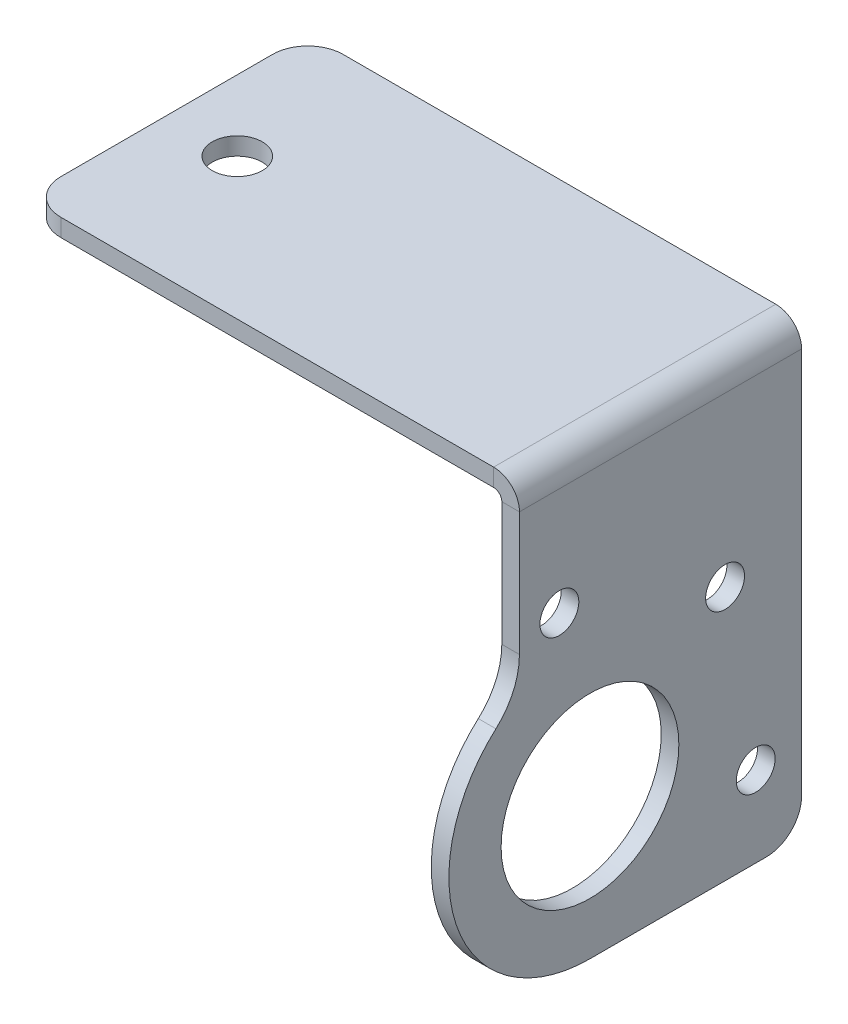
from build123d import *

# Parameters (mm, degrees)
SKETCH1_R                    = 2.25
SKETCH1_R_2                  = 8
SKETCH1_R_3                  = 1.75
BASE_FLANGE1_DEPTH           = 1.5875
SKETCHED_START               = 38.1
SKETCHED_BEND1_OUTLINE_W     = 1.5875
SKETCHED_BEND1_OUTLINE_H     = 25.4
SKETCHED_BEND1_DEPTH         = 38.1
SKETCHED_START_2             = 36.5125
SKETCHED_BEND1_2_OUTLINE_R   = 1.75
SKETCHED_BEND1_2_OUTLINE_R_2 = 8
SKETCHED_BEND1_2_DEPTH       = 1.361458034
SKETCHED_START_3             = 35.7759
SKETCHED_BEND1_3_OUTLINE_R   = 1.75
SKETCHED_BEND1_3_OUTLINE_R_2 = 8
SKETCHED_BEND1_3_DEPTH       = 2.3241
SKETCHED_START_4             = -12.7
SKETCHED_BEND1_4_DEPTH       = 31.75
SKETCHED_START_5             = -1.5875
SKETCHED_BEND1_5_DEPTH       = 1.5875


with BuildPart() as part:
    # Base-Flange1: sheet metal written as solids
    # Sketch1 → Base-Flange1 (new body)
    with BuildSketch(Plane(origin=(0, 0, 0), x_dir=(1, 0, 0), z_dir=(0, 1, 0))):
        with BuildLine():
            Line((-3.175, 12.7), (38.1, 12.7))
            Line((38.1, 12.7), (73.025, 12.7))
            ThreePointArc((73.025, 12.7), (75.27006403, 11.77006403), (76.2, 9.525))
            Line((76.2, 9.525), (76.2, -6.35))
            ThreePointArc((76.2, -6.35), (68.03164054, -18.213988959), (54.033978895, -14.816666667))
            ThreePointArc((54.033978895, -14.816666667), (51.893344987, -13.2532696), (49.300968343, -12.7))
            Line((49.300968343, -12.7), (38.1, -12.7))
            Line((38.1, -12.7), (-3.175, -12.7))
            ThreePointArc((-3.175, -12.7), (-5.42006403, -11.77006403), (-6.35, -9.525))
            Line((-6.35, -9.525), (-6.35, 9.525))
            ThreePointArc((-6.35, 9.525), (-5.42006403, 11.77006403), (-3.175, 12.7))
        make_face()
        with Locations(Location((0, 0, 0), (0, 0, 270))):
            Circle(SKETCH1_R, mode=Mode.SUBTRACT)
        with Locations(Location((63.5, -6.35, 0), (0, 0, 270))):
            Circle(SKETCH1_R_2, mode=Mode.SUBTRACT)
        with Locations(Location((47.866176921, -9.10666482, 0), (0, 0, 270))):
            Circle(SKETCH1_R_3, mode=Mode.SUBTRACT)
        with Locations(Location((53.295746696, 5.810955535, 0), (0, 0, 270))):
            Circle(SKETCH1_R_3, mode=Mode.SUBTRACT)
        with Locations(Location((68.929569775, 8.567620355, 0), (0, 0, 270))):
            Circle(SKETCH1_R_3, mode=Mode.SUBTRACT)
    extrude(amount=-BASE_FLANGE1_DEPTH)

    # Sketched Bend1: read off the stored shape, not the designer's step
    # Sketched Bend1 outline → Sketched Bend1 (cut)
    with BuildSketch(Plane.YZ.offset(SKETCHED_START)):
        with Locations((-0.79375, 0)):
            Rectangle(SKETCHED_BEND1_OUTLINE_W, SKETCHED_BEND1_OUTLINE_H)
    extrude(amount=SKETCHED_BEND1_DEPTH, mode=Mode.SUBTRACT)

    # Sketched Bend1 2 outline → Sketched Bend1 2 (add)
    with BuildSketch(Plane.YZ.offset(SKETCHED_START_2)):
        with BuildLine():
            Line((-1.5875, 12.7), (-13.445300184, 12.7))
            ThreePointArc((-13.445300184, 12.7), (-16.037676829, 13.2532696), (-18.178310737, 14.816666667))
            ThreePointArc((-18.178310737, 14.816666667), (-32.175972382, 18.213988959), (-40.344331841, 6.35))
            Line((-40.344331841, 6.35), (-40.344331841, -9.525))
            ThreePointArc((-40.344331841, -9.525), (-39.414395871, -11.77006403), (-37.169331841, -12.7))
            Line((-37.169331841, -12.7), (-1.5875, -12.7))
            Line((-1.5875, -12.7), (-1.5875, 12.7))
        make_face()
        with Locations((-33.073901617, -8.567620355)):
            Circle(SKETCHED_BEND1_2_OUTLINE_R, mode=Mode.SUBTRACT)
        with Locations((-17.440078538, -5.810955535)):
            Circle(SKETCHED_BEND1_2_OUTLINE_R, mode=Mode.SUBTRACT)
        with Locations((-27.644331841, 6.35)):
            Circle(SKETCHED_BEND1_2_OUTLINE_R_2, mode=Mode.SUBTRACT)
        with Locations((-12.010508762, 9.10666482)):
            Circle(SKETCHED_BEND1_2_OUTLINE_R, mode=Mode.SUBTRACT)
    extrude(amount=SKETCHED_BEND1_2_DEPTH)

    # Sketched Bend1 3 outline → Sketched Bend1 3 (add)
    with BuildSketch(Plane.YZ.offset(SKETCHED_START_3)):
        with BuildLine():
            Line((-1.5875, 12.7), (-13.445300184, 12.7))
            ThreePointArc((-13.445300184, 12.7), (-16.037676829, 13.2532696), (-18.178310737, 14.816666667))
            ThreePointArc((-18.178310737, 14.816666667), (-32.175972382, 18.213988959), (-40.344331841, 6.35))
            Line((-40.344331841, 6.35), (-40.344331841, -9.525))
            ThreePointArc((-40.344331841, -9.525), (-39.414395871, -11.77006403), (-37.169331841, -12.7))
            Line((-37.169331841, -12.7), (-1.5875, -12.7))
            Line((-1.5875, -12.7), (-1.5875, 12.7))
        make_face()
        with Locations((-33.073901617, -8.567620355)):
            Circle(SKETCHED_BEND1_3_OUTLINE_R, mode=Mode.SUBTRACT)
        with Locations((-17.440078538, -5.810955535)):
            Circle(SKETCHED_BEND1_3_OUTLINE_R, mode=Mode.SUBTRACT)
        with Locations((-27.644331841, 6.35)):
            Circle(SKETCHED_BEND1_3_OUTLINE_R_2, mode=Mode.SUBTRACT)
        with Locations((-12.010508762, 9.10666482)):
            Circle(SKETCHED_BEND1_3_OUTLINE_R, mode=Mode.SUBTRACT)
    extrude(amount=SKETCHED_BEND1_3_DEPTH)

    # Sketched Bend1 4 outline → Sketched Bend1 4 (cut)
    with BuildSketch(Plane.XY.offset(SKETCHED_START_4)):
        with BuildLine():
            ThreePointArc((35.7759, 0), (37.41928687, -0.68071313), (38.1, -2.3241))
            Line((38.1, -2.3241), (38.1, 0))
            Line((38.1, 0), (35.7759, 0))
        make_face()
        with BuildLine():
            Line((36.5125, -40.344331841), (36.5125, -2.3241))
            ThreePointArc((36.5125, -2.3241), (36.296754855, -1.803245145), (35.7759, -1.5875))
            Line((35.7759, -1.5875), (35.7759, -40.344331841))
            Line((35.7759, -40.344331841), (36.5125, -40.344331841))
        make_face()
    extrude(amount=SKETCHED_BEND1_4_DEPTH, mode=Mode.SUBTRACT)

    # Sketched Bend1 5 outline → Sketched Bend1 5 (cut)
    with BuildSketch(Plane(origin=(0, 0, 0), x_dir=(1, 0, 0), z_dir=(0, 1, 0)).offset(SKETCHED_START_5)):
        with BuildLine():
            ThreePointArc((49.300968343, -12.7), (51.893344987, -13.2532696), (54.033978895, -14.816666667))
            ThreePointArc((54.033978895, -14.816666667), (64.80660234, -18.982608215), (74.498522628, -12.7))
            Line((74.498522628, -12.7), (68.365953144, -12.7))
            ThreePointArc((68.365953144, -12.7), (63.5, -14.35), (58.634046856, -12.7))
            Line((58.634046856, -12.7), (49.300968343, -12.7))
        make_face()
    extrude(amount=SKETCHED_BEND1_5_DEPTH, mode=Mode.SUBTRACT)


solid = part.part
